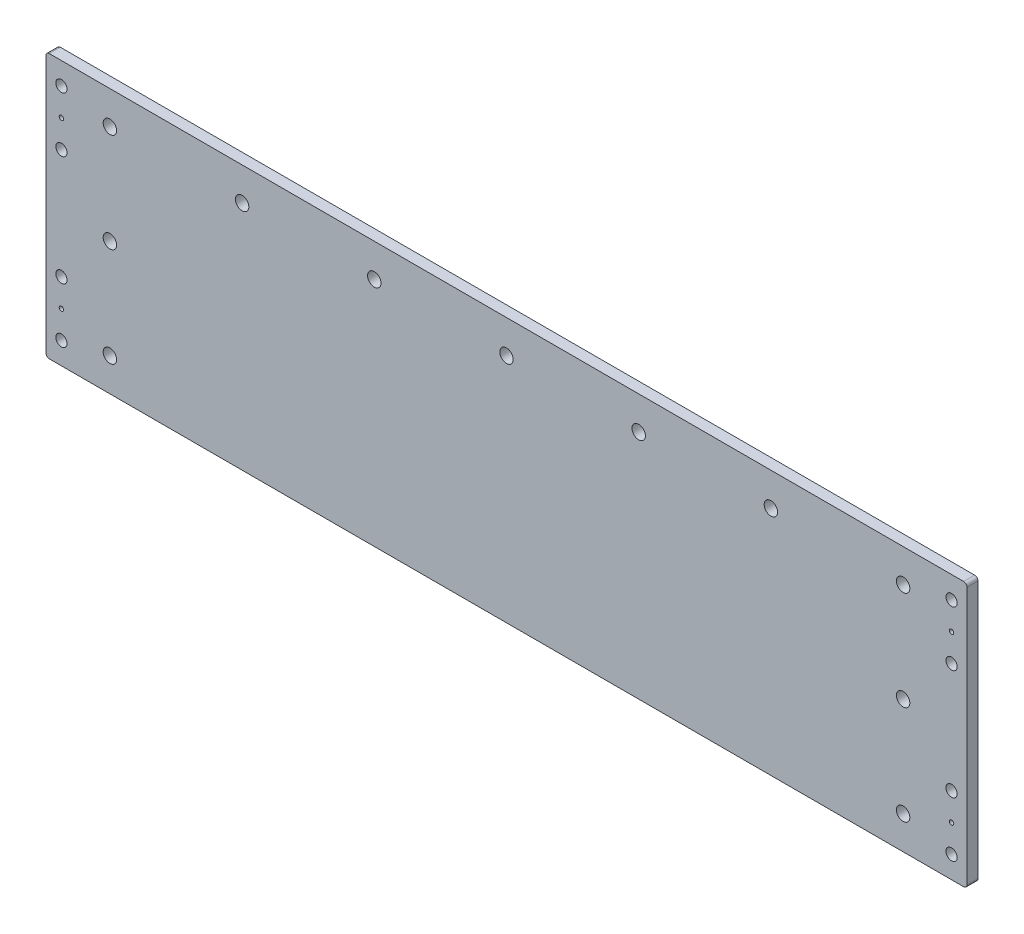
from build123d import *

# Parameters (mm, degrees)
SKETCH1_W                 = 418
SKETCH1_H                 = 120
BOSS_EXTRUDE1_DEPTH       = 2.5
SKETCH3_R                 = 3.05
CUT_EXTRUDE2_DEPTH        = 218.499425287
FILLET1_R                 = 1.5
SKETCH4_R                 = 2.55
SKETCH4_R_2               = 1
CUT_EXTRUDE3_DEPTH        = 218.499425287
MIRROR2_COPY_1_SKETCH_R   = 2.55
MIRROR2_COPY_1_SKETCH_R_2 = 1
MIRROR2_COPY_1_DEPTH      = 218.499425287


with BuildPart() as part:
    # Sketch1 → Boss-Extrude1 (new, symmetric)
    with BuildSketch(Plane.XY):
        Rectangle(SKETCH1_W, SKETCH1_H)
    extrude(amount=BOSS_EXTRUDE1_DEPTH, both=True)

    # Sketch3 → Cut-Extrude2 (cut, through all)
    with BuildSketch(Plane.XY.offset(2.5)):
        with Locations((-180, 45)):
            Circle(SKETCH3_R)
        with Locations((180, 45)):
            Circle(SKETCH3_R)
        with Locations((180, -45)):
            Circle(SKETCH3_R)
        with Locations((-180, -45)):
            Circle(SKETCH3_R)
        with Locations((0, 45)):
            Circle(SKETCH3_R)
        with Locations((-120, 45)):
            Circle(SKETCH3_R)
        with Locations((120, 45)):
            Circle(SKETCH3_R)
        with Locations((-180, 0)):
            Circle(SKETCH3_R)
        with Locations((-60, 45)):
            Circle(SKETCH3_R)
        with Locations((60, 45)):
            Circle(SKETCH3_R)
        with Locations((180, 0)):
            Circle(SKETCH3_R)
    extrude(amount=-CUT_EXTRUDE2_DEPTH, mode=Mode.SUBTRACT)

    # Fillet1
    fillet1_edges = [part.edges().sort_by_distance(p)[0] for p in [
        (-209, -60, 0),
        (209, -60, 0),
        (209, 60, 0),
        (-209, 60, 0),
    ]]
    fillet(fillet1_edges, radius=FILLET1_R)

    # Sketch4 → Cut-Extrude3 (cut, through all)
    with BuildSketch(Plane.XY.offset(2.5)):
        with Locations((-202, 50)):
            Circle(SKETCH4_R)
        with Locations((-202, 37.5)):
            Circle(SKETCH4_R_2)
        with Locations((-202, 25)):
            Circle(SKETCH4_R)
    cut_extrude3 = extrude(amount=-CUT_EXTRUDE3_DEPTH, mode=Mode.SUBTRACT)

    # Mirror1: Cut-Extrude3 across plane
    add(cut_extrude3.mirror(Plane.ZX), mode=Mode.SUBTRACT)

    # Mirror2: Cut-Extrude3 across plane
    add(cut_extrude3.mirror(Plane(origin=(0, 0, 0), x_dir=(0, 0, 1), z_dir=(1, 0, 0))), mode=Mode.SUBTRACT)

    # Mirror2 copy 1 sketch → Mirror2 copy 1 (cut, through all)
    with BuildSketch(Plane(origin=(0, 0, 2.5), x_dir=(-1, 0, 0), z_dir=(0, 0, 1))):
        with Locations((-202, 50)):
            Circle(MIRROR2_COPY_1_SKETCH_R)
        with Locations((-202, 37.5)):
            Circle(MIRROR2_COPY_1_SKETCH_R_2)
        with Locations((-202, 25)):
            Circle(MIRROR2_COPY_1_SKETCH_R)
    extrude(amount=-MIRROR2_COPY_1_DEPTH, mode=Mode.SUBTRACT)


solid = part.part
